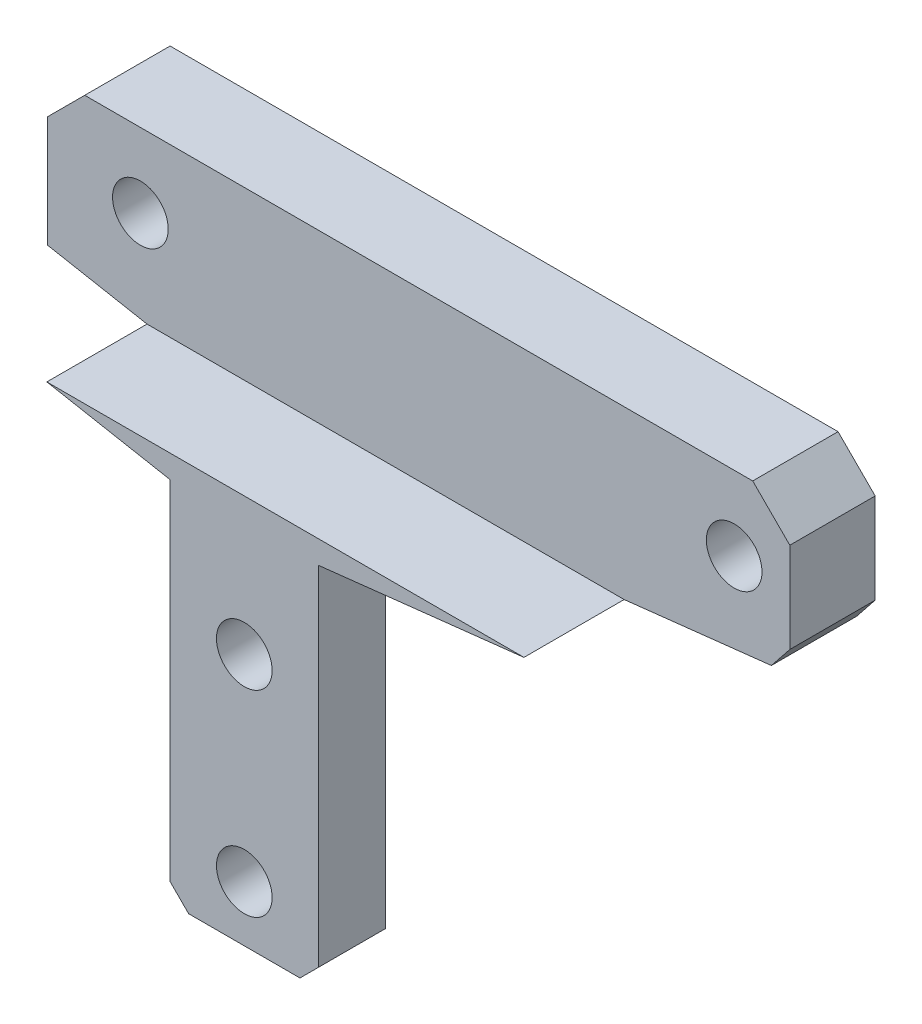
from build123d import *

# Parameters (mm, degrees)
SKETCH_1_R          = 0.75
EXTRUDE_2_DEPTH     = 5.5
SKETCH_3_W          = 4
SKETCH_3_H          = 9.88
SKETCH_3_R          = 0.75
CUT_EXTRUDE_2_DEPTH = 4.2
CHAMFER_1_SIZE      = 1
CHAMFER_2_SIZE      = 1
CHAMFER_3_SIZE      = 0.5
CUT_EXTRUDE_START   = -2.2
SKETCH_4_R          = 0.75
CUT_EXTRUDE_3_DEPTH = 2.2
CHAMFER_4_SIZE      = 0.5
CHAMFER_4_SIZE2     = 0.566583589
SKETCH_5_R          = 0.75
CUT_EXTRUDE_4_DEPTH = 1
SKETCH_6_R          = 0.75
EXTRUDE_3_DEPTH     = 0.5


with BuildPart() as part:
    # 草图1 → 凸台-拉伸2 (new body)
    with BuildSketch(Plane.XY):
        Polygon((-10, 2), (10, 2), (10, -2), (0, -3.12), (0, -13), (-4, -13), (-4, -3.12), (-10, -2), align=None)
        with Locations((-7.5, 0)):
            Circle(SKETCH_1_R, mode=Mode.SUBTRACT)
        with Locations((8.5, 0)):
            Circle(SKETCH_1_R, mode=Mode.SUBTRACT)
        with Locations((-2, -11.5)):
            Circle(SKETCH_1_R, mode=Mode.SUBTRACT)
        with Locations((-2, -6.2)):
            Circle(SKETCH_1_R, mode=Mode.SUBTRACT)
    extrude(amount=EXTRUDE_2_DEPTH)

    # 草图3 → 切除-拉伸2 (cut)
    with BuildSketch(Plane(origin=(0, 0, 0), x_dir=(-1, 0, 0), z_dir=(0, 0, -1))):
        with Locations((2, -8.06)):
            Rectangle(SKETCH_3_W, SKETCH_3_H)
        with Locations((2, -11.5)):
            Circle(SKETCH_3_R, mode=Mode.SUBTRACT)
        with Locations((2, -6.2)):
            Circle(SKETCH_3_R, mode=Mode.SUBTRACT)
    extrude(amount=-CUT_EXTRUDE_2_DEPTH, mode=Mode.SUBTRACT)

    # 倒角1
    chamfer_1_edges = [part.edges().sort_by_distance(p)[0] for p in [
        (-2, -3.12, 4.2),
    ]]
    chamfer(chamfer_1_edges, length=CHAMFER_1_SIZE)

    # 倒角2
    chamfer_2_edges = [part.edges().sort_by_distance(p)[0] for p in [
        (-10, 2, 2.75),
        (10, 2, 2.75),
    ]]
    chamfer(chamfer_2_edges, length=CHAMFER_2_SIZE)

    # 倒角3
    chamfer_3_edges = [part.edges().sort_by_distance(p)[0] for p in [
        (-4, -13, 4.85),
        (0, -13, 4.85),
    ]]
    chamfer(chamfer_3_edges, length=CHAMFER_3_SIZE)

    # 草图4 → 切除-拉伸3 (cut)
    with BuildSketch(Plane.XY.offset(5.5).offset(CUT_EXTRUDE_START)):
        Polygon((-10, -2.5), (10, -2.5), (10, 1), (9, 2), (-9, 2), (-10, 1), align=None)
        with Locations((8.5, 0)):
            Circle(SKETCH_4_R, mode=Mode.SUBTRACT)
        with Locations((-7.5, 0)):
            Circle(SKETCH_4_R, mode=Mode.SUBTRACT)
    extrude(amount=CUT_EXTRUDE_3_DEPTH, mode=Mode.SUBTRACT)

    # 倒角4
    chamfer_4_edges = [part.edges().sort_by_distance(p)[0] for p in [
        (10, -2, 1.65),
    ]]
    chamfer_4_side = [part.faces().sort_by_distance(p)[0] for p in [
        (4.398291925, -2.627391304, 2.391304348),
    ]]
    chamfer(chamfer_4_edges, length=CHAMFER_4_SIZE, length2=CHAMFER_4_SIZE2, reference=chamfer_4_side[0])

    # 草图5 → 切除-拉伸4 (cut)
    with BuildSketch(Plane(origin=(0, 0, 0), x_dir=(-1, 0, 0), z_dir=(0, 0, -1))):
        Polygon((-10, 1), (-10, -1.433416411), (-9.503106802, -2.055652038), (0, -3.12), (4, -3.12), (10, -2), (10, 1), (9, 2), (-9, 2), align=None)
        with Locations((7.5, 0)):
            Circle(SKETCH_5_R, mode=Mode.SUBTRACT)
        with Locations((-8.5, 0)):
            Circle(SKETCH_5_R, mode=Mode.SUBTRACT)
    extrude(amount=-CUT_EXTRUDE_4_DEPTH, mode=Mode.SUBTRACT)

    # 草图6 → 凸台-拉伸3 (add)
    with BuildSketch(Plane.XY.offset(5.5)):
        Polygon((0, -3.12), (5.535714286, -2.5), (-7.321428571, -2.5), (-4, -3.12), (-4, -12.5), (-3.5, -13), (-0.5, -13), (0, -12.5), align=None)
        with Locations((-2, -11.5)):
            Circle(SKETCH_6_R, mode=Mode.SUBTRACT)
        with Locations((-2, -6.2)):
            Circle(SKETCH_6_R, mode=Mode.SUBTRACT)
    extrude(amount=EXTRUDE_3_DEPTH)


solid = part.part
